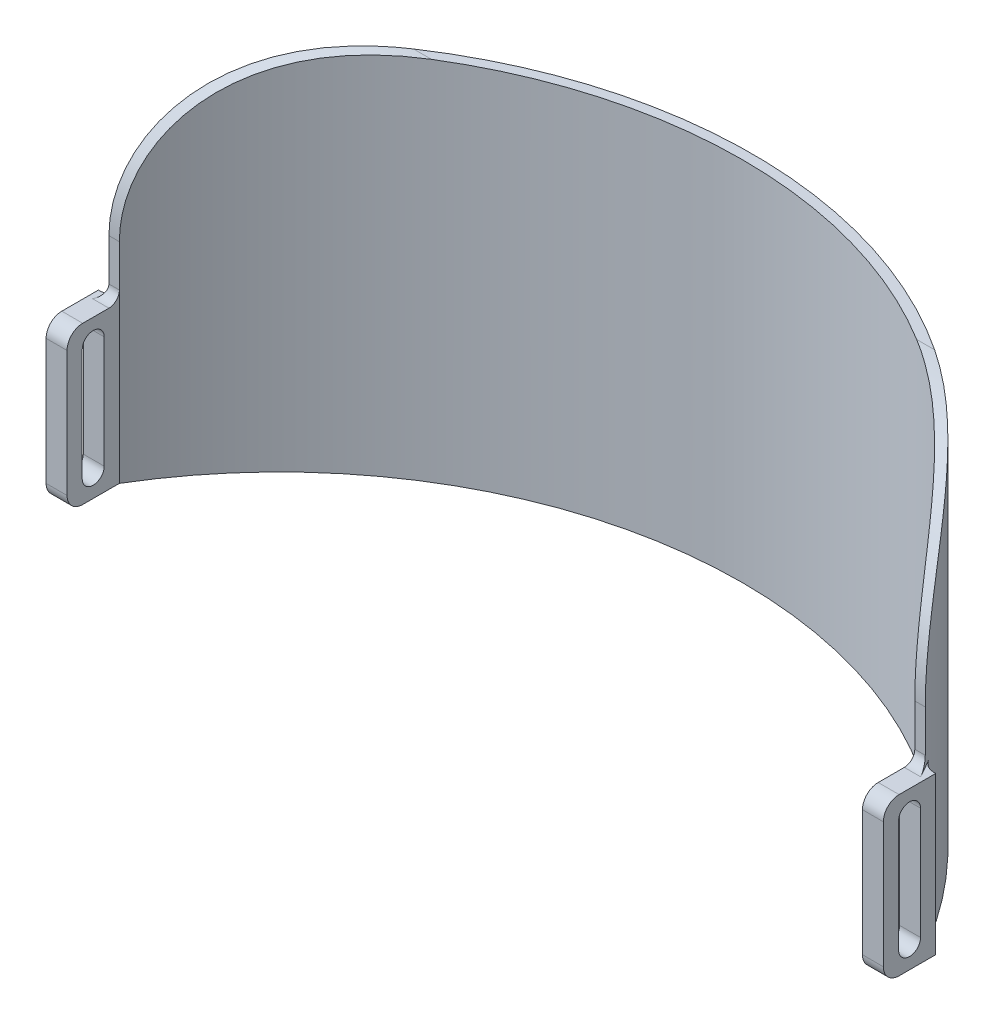
from build123d import *

# Parameters (mm, degrees)
BOSS_EXTRUDE1_DEPTH = 70
SKETCH3_W           = 4
SKETCH3_H           = 30
BOSS_EXTRUDE2_DEPTH = 10
CUT_EXTRUDE1_DEPTH  = 168
FILLET2_R           = 3
FILLET3_R           = 2
FILLET4_R           = 30


with BuildPart() as part:
    # Sketch1 → Boss-Extrude1 (new body)
    with BuildSketch(Plane(origin=(0, 0, 0), x_dir=(1, 0, 0), z_dir=(0, 1, 0))):
        with BuildLine():
            Line((-78, 0), (-76, 0))
            ThreePointArc((-76, 0), (0, 43.107230832), (76, 0))
            Line((76, 0), (78, 0))
            ThreePointArc((78, 0), (0, 45.008730356), (-78, 0))
        make_face()
    extrude(amount=BOSS_EXTRUDE1_DEPTH)

    # Sketch3 → Boss-Extrude2 (add)
    with BuildSketch(Plane.XY):
        with Locations((-78, 15)):
            Rectangle(SKETCH3_W, SKETCH3_H)
        with Locations((78, 15)):
            Rectangle(SKETCH3_W, SKETCH3_H)
    extrude(amount=BOSS_EXTRUDE2_DEPTH)

    # Sketch4 → Cut-Extrude1 (cut)
    with BuildSketch(Plane.ZY.offset(80)):
        with BuildLine():
            Line((7.1, 25.7), (7.1, 4.3))
            ThreePointArc((7.1, 4.3), (5, 2.2), (2.9, 4.3))
            Line((2.9, 4.3), (2.9, 25.7))
            ThreePointArc((2.9, 25.7), (5, 27.8), (7.1, 25.7))
        make_face()
    extrude(amount=-CUT_EXTRUDE1_DEPTH, mode=Mode.SUBTRACT)

    # Fillet2
    fillet2_edges = [part.edges().sort_by_distance(p)[0] for p in [
        (-78, 15, 0),
        (-78, 30, 10),
        (-78, 0, 10),
        (78, 0, 10),
        (78, 30, 10),
        (78, 15, 0),
    ]]
    fillet(fillet2_edges, radius=FILLET2_R)

    # Fillet3
    fillet3_edges = [part.edges().sort_by_distance(p)[0] for p in [
        (-77, 30, 0),
        (77, 30, 0),
    ]]
    fillet(fillet3_edges, radius=FILLET3_R)

    # Fillet4
    # the kernel refuses this fillet: 30 mm, written as the material it takes off along each edge
    with BuildSketch(Plane(origin=(-153, 70, 0), x_dir=(0, 0, -1), z_dir=(1, 0, 0))) as fillet4_piece_1:
        with BuildLine():
            CenterArc((FILLET4_R, -FILLET4_R), FILLET4_R, 90, 90)
            Line((0, -FILLET4_R), (0, 0))
            Line((0, 0), (FILLET4_R, 0))
        make_face()
    extrude(amount=152, mode=Mode.SUBTRACT)
    with BuildSketch(Plane(origin=(1, 70, 0), x_dir=(0, -1, 0), z_dir=(1, 0, 0))) as fillet4_piece_2:
        with BuildLine():
            CenterArc((FILLET4_R, FILLET4_R), FILLET4_R, 180, 90)
            Line((0, FILLET4_R), (0, 0))
            Line((0, 0), (FILLET4_R, 0))
        make_face()
    extrude(amount=152, mode=Mode.SUBTRACT)


solid = part.part
